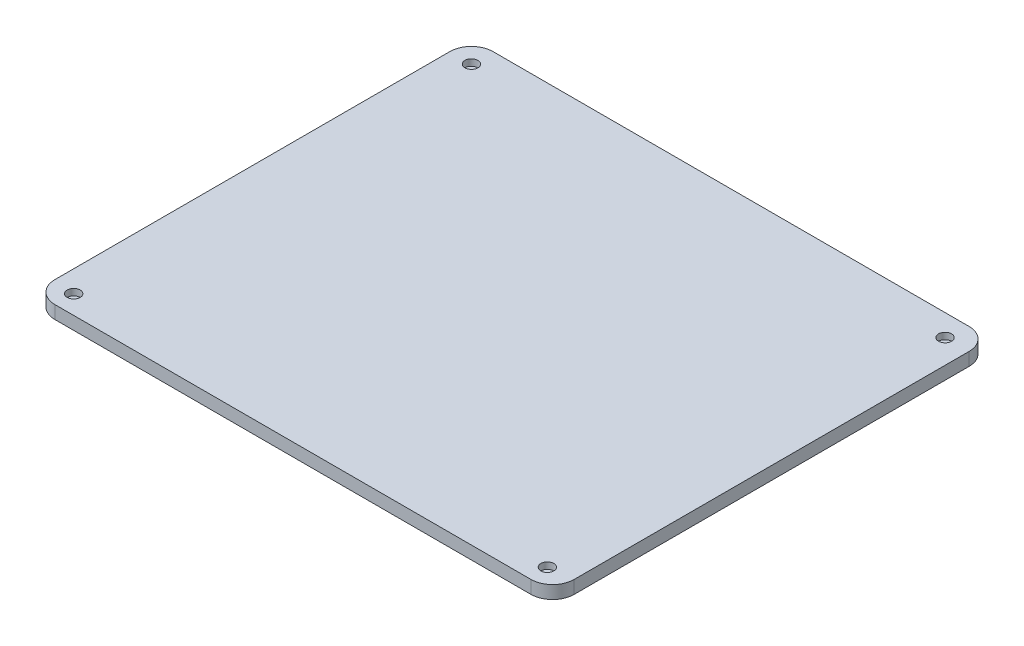
from build123d import *

# Parameters (mm, degrees)
SKETCH1_W           = 120
SKETCH1_H           = 101.25
BOSS_EXTRUDE1_DEPTH = 3
FILLET1_R           = 5
SKETCH2_R           = 1.5
CUT_EXTRUDE1_DEPTH  = 1.5


with BuildPart() as part:
    # Sketch1 → Boss-Extrude1 (new body)
    with BuildSketch(Plane(origin=(0, 0, 0), x_dir=(1, 0, 0), z_dir=(0, 1, 0))):
        Rectangle(SKETCH1_W, SKETCH1_H)
    extrude(amount=BOSS_EXTRUDE1_DEPTH)

    # Fillet1
    fillet1_edges = [part.edges().sort_by_distance(p)[0] for p in [
        (-60, 1.5, -50.625),
        (60, 1.5, -50.625),
        (60, 1.5, 50.625),
        (-60, 1.5, 50.625),
    ]]
    fillet(fillet1_edges, radius=FILLET1_R)

    # Sketch2 → Cut-Extrude1 (cut)
    with BuildSketch(Plane(origin=(0, 3, 0), x_dir=(1, 0, 0), z_dir=(0, 1, 0))):
        with Locations((-55, 45.625)):
            Circle(SKETCH2_R)
        with Locations((54.451089289, 45.625)):
            Circle(SKETCH2_R)
        with Locations((-55, -46.279992662)):
            Circle(SKETCH2_R)
        with Locations((54.451089289, -46.279992662)):
            Circle(SKETCH2_R)
    extrude(amount=-CUT_EXTRUDE1_DEPTH, mode=Mode.SUBTRACT)


solid = part.part
